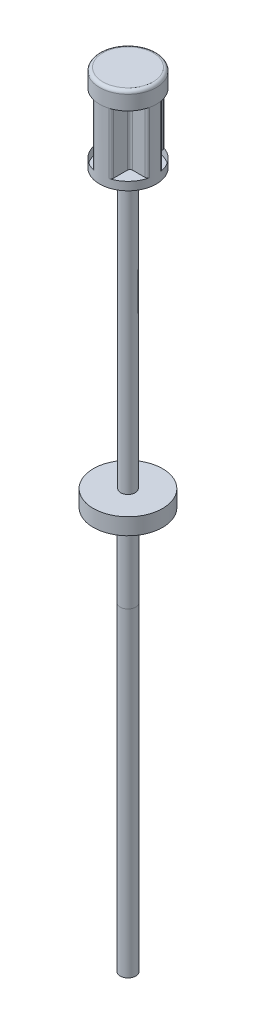
from build123d import *

# Parameters (mm, degrees)
SKETCH1_R           = 0.95
SKETCH5_W           = 4.2
SKETCH5_H           = 2
SKETCH6_R           = 0.885
BOSS_EXTRUDE1_DEPTH = 33.75
SKETCH7_R           = 3.45
BOSS_EXTRUDE2_DEPTH = 1
BOSS_EXTRUDE3_DEPTH = 7.4
SKETCH11_R          = 3.45
BOSS_EXTRUDE4_DEPTH = 2.15
SKETCH12_R          = 5.053108697
SKETCH12_R_2        = 3.449578042
CUT_EXTRUDE1_DEPTH  = 10
FILLET4_R           = 0.4
FILLET5_R           = 0.3
CUT_EXTRUDE2_START  = -3.09
SKETCH15_R          = 0.95
CUT_EXTRUDE2_DEPTH  = 3.09


with BuildPart() as part:
    # Sweep1: sweep along a path in Sketch2
    with BuildLine(Plane(origin=(0, 0, 0), x_dir=(0, 0, -1), z_dir=(1, 0, 0))) as sweep1_path:
        Line((0, 0), (0, 41.9))
        Line((0, 41.9), (0, 51.9))
    # Sketch1 → Sweep1 (sweep)
    with BuildSketch(Plane(origin=(0, 0, 0), x_dir=(1, 0, 0), z_dir=(0, 1, 0))):
        Circle(SKETCH1_R)
    sweep(path=sweep1_path.line)

    # Sketch5 → Revolve1 (revolve)
    with BuildSketch(Plane(origin=(0, 0, 0), x_dir=(0, 0, -1), z_dir=(1, 0, 0))):
        with Locations((-2.1, 52.9)):
            Rectangle(SKETCH5_W, SKETCH5_H)
    revolve(axis=Axis((0, 53.9, 0), (0, -1, 0)))

    # Sketch6 → Boss-Extrude1 (add)
    with BuildSketch(Plane(origin=(0, 53.9, 0), x_dir=(1, 0, 0), z_dir=(0, 1, 0))):
        with Locations(Location((0, 0, 0), (0, 0, 270))):
            Circle(SKETCH6_R)
    extrude(amount=BOSS_EXTRUDE1_DEPTH)

    # Sketch7 → Boss-Extrude2 (add)
    with BuildSketch(Plane(origin=(0, 87.65, 0), x_dir=(1, 0, 0), z_dir=(0, 1, 0))):
        with Locations(Location((0, 0, 0), (0, 0, 270))):
            Circle(SKETCH7_R)
    extrude(amount=BOSS_EXTRUDE2_DEPTH)

    # Sketch8 → Boss-Extrude3 (add)
    with BuildSketch(Plane(origin=(0, 88.65, 0), x_dir=(1, 0, 0), z_dir=(0, 1, 0))):
        Polygon((1.230053166, 0.811701691), (1.230053166, 3.298725541), (-1.010400815, 3.298725541), (-1.010400815, 0.811701691), (-3.353153794, 0.811701691), (-3.353153794, -0.988158581), (-1.010400815, -0.988158581), (-1.010400815, -4.015839789), (1.230053166, -4.015839789), (1.230053166, -0.988158581), (4.082100271, -0.988158581), (4.082100271, 0.811701691), align=None)
    extrude(amount=BOSS_EXTRUDE3_DEPTH)

    # Sketch11 → Boss-Extrude4 (add)
    with BuildSketch(Plane(origin=(0, 96.05, 0), x_dir=(1, 0, 0), z_dir=(0, 1, 0))):
        with Locations(Location((0, 0, 0), (0, 0, 107.029845203))):
            Circle(SKETCH11_R)
    extrude(amount=BOSS_EXTRUDE4_DEPTH)

    # Sketch12 → Cut-Extrude1 (cut)
    with BuildSketch(Plane(origin=(0, 96.05, 0), x_dir=(1, 0, 0), z_dir=(0, 1, 0))):
        Circle(SKETCH12_R)
        with Locations(Location((0, 0, 0), (0, 0, 270))):
            Circle(SKETCH12_R_2, mode=Mode.SUBTRACT)
    extrude(amount=-CUT_EXTRUDE1_DEPTH, mode=Mode.SUBTRACT)

    # Fillet4
    fillet4_edges = [part.edges().sort_by_distance(p)[0] for p in [
        (1.010400815, 98.2, 3.298725541),
    ]]
    fillet(fillet4_edges, radius=FILLET4_R)

    # Fillet5
    # the kernel refuses this fillet: 0.3 mm, written as the material it adds along each edge
    with BuildSketch(Plane(origin=(-1.010400815, 87.9, -0.811701691), x_dir=(-1, 0, 0), z_dir=(0, 1, 0)), Plane(origin=(-1.010400815, 87.9, 0.988158581), x_dir=(0, 0, 1), z_dir=(0, 1, 0)), Plane(origin=(1.230053166, 87.9, -0.811701691), x_dir=(0, 0, -1), z_dir=(0, 1, 0)), Plane(origin=(1.230053166, 87.9, 0.988158581), x_dir=(1, 0, 0), z_dir=(0, 1, 0))) as fillet5_piece_1:
        with BuildLine():
            CenterArc((FILLET5_R, -FILLET5_R), FILLET5_R, 90, 90)
            Line((0, -FILLET5_R), (0, 0))
            Line((0, 0), (FILLET5_R, 0))
        make_face()
    extrude(amount=8.9)
    # the kernel refuses this fillet: 0.3 mm, written as the material it takes off along each edge
    with BuildSketch(Plane(origin=(1.230053166, 88.65, -3.222818313), x_dir=(-0.9453321678939596, 0, -0.32610901911003093), z_dir=(0, 1, 0))) as fillet5_2_piece_1:
        with BuildLine():
            CenterArc((0.213912859, 0.299842347), FILLET5_R, 199.032778114, 72.824800523)
            Line((-0.069686792, 0.202009641), (0, 0))
            ThreePointArc((0, 0), (0.111818707, -0.001812788), (0.223637414, 0))
        make_face()
    extrude(amount=7.4, mode=Mode.SUBTRACT)
    with BuildSketch(Plane(origin=(-1.010400815, 88.65, -3.29828423), x_dir=(0.9657732786653868, 0, -0.2593876909491066), z_dir=(0, 1, 0))) as fillet5_2_piece_2:
        with BuildLine():
            CenterArc((0.230106816, -0.299817566), FILLET5_R, 88.00174108, 76.964525917)
            Line((-0.059625168, -0.222001259), (0, 0))
            ThreePointArc((0, 0), (0.120283777, 0.002097733), (0.240567554, 0))
        make_face()
    extrude(amount=7.4, mode=Mode.SUBTRACT)
    with BuildSketch(Plane(origin=(-3.352719647, 88.65, -0.811701691), x_dir=(-0.1990231654762503, 0, 0.9799947854982765), z_dir=(0, 1, 0))) as fillet5_2_piece_3:
        with BuildLine():
            CenterArc((0.24524038, 0.299792772), FILLET5_R, 191.479842228, 80.649895998)
            Line((-0.048758056, 0.240085822), (0, 0))
            ThreePointArc((0, 0), (0.128194548, -0.002382831), (0.256389095, 0))
        make_face()
    extrude(amount=7.4, mode=Mode.SUBTRACT)
    with BuildSketch(Plane(origin=(-3.30501608, 88.65, 0.988158581), x_dir=(-0.2526309264333675, 0, -0.9675627189022004), z_dir=(0, 1, 0))) as fillet5_2_piece_4:
        with BuildLine():
            CenterArc((0.231775654, -0.29981491), FILLET5_R, 87.987242866, 77.37950549)
            Line((-0.058493162, -0.224025632), (0, 0))
            ThreePointArc((0, 0), (0.121156129, 0.00212828), (0.242312258, 0))
        make_face()
    extrude(amount=7.4, mode=Mode.SUBTRACT)
    with BuildSketch(Plane(origin=(-1.010400815, 88.65, 3.29828423), x_dir=(0.9657732786653864, 0, 0.25938769094910785), z_dir=(0, 1, 0))) as fillet5_2_piece_5:
        with BuildLine():
            CenterArc((0.230106816, 0.299817566), FILLET5_R, 195.033733003, 76.964525917)
            Line((-0.059625168, 0.222001259), (0, 0))
            ThreePointArc((0, 0), (0.120283777, -0.002097733), (0.240567554, 0))
        make_face()
    extrude(amount=7.4, mode=Mode.SUBTRACT)
    with BuildSketch(Plane(origin=(1.230053166, 88.65, 3.222818313), x_dir=(-0.9453321678939602, 0, 0.32610901911002915), z_dir=(0, 1, 0))) as fillet5_2_piece_6:
        with BuildLine():
            CenterArc((0.213912859, -0.299842347), FILLET5_R, 88.142421362, 72.824800523)
            Line((-0.069686792, -0.202009641), (0, 0))
            ThreePointArc((0, 0), (0.111818707, 0.001812788), (0.223637414, 0))
        make_face()
    extrude(amount=7.4, mode=Mode.SUBTRACT)
    with BuildSketch(Plane(origin=(3.30501608, 88.65, 0.988158581), x_dir=(0.2526309264333699, 0, -0.9675627189021997), z_dir=(0, 1, 0))) as fillet5_2_piece_7:
        with BuildLine():
            CenterArc((0.231775654, 0.29981491), FILLET5_R, 194.633251644, 77.37950549)
            Line((-0.058493162, 0.224025632), (0, 0))
            ThreePointArc((0, 0), (0.121156129, -0.00212828), (0.242312258, 0))
        make_face()
    extrude(amount=7.4, mode=Mode.SUBTRACT)
    with BuildSketch(Plane(origin=(3.352719647, 88.65, -0.811701691), x_dir=(0.19902316547625037, 0, 0.9799947854982765), z_dir=(0, 1, 0))) as fillet5_2_piece_8:
        with BuildLine():
            CenterArc((0.24524038, -0.299792772), FILLET5_R, 87.870261774, 80.649895998)
            Line((-0.048758056, -0.240085822), (0, 0))
            ThreePointArc((0, 0), (0.128194548, 0.002382831), (0.256389095, 0))
        make_face()
    extrude(amount=7.4, mode=Mode.SUBTRACT)

    # Sketch15 → Cut-Extrude2 (cut)
    with BuildSketch(Plane.XZ.offset(CUT_EXTRUDE2_START)):
        with Locations(Location((0, 0, 0), (0, 0, 90))):
            Circle(SKETCH15_R)
    extrude(amount=CUT_EXTRUDE2_DEPTH, mode=Mode.SUBTRACT)


solid = part.part
